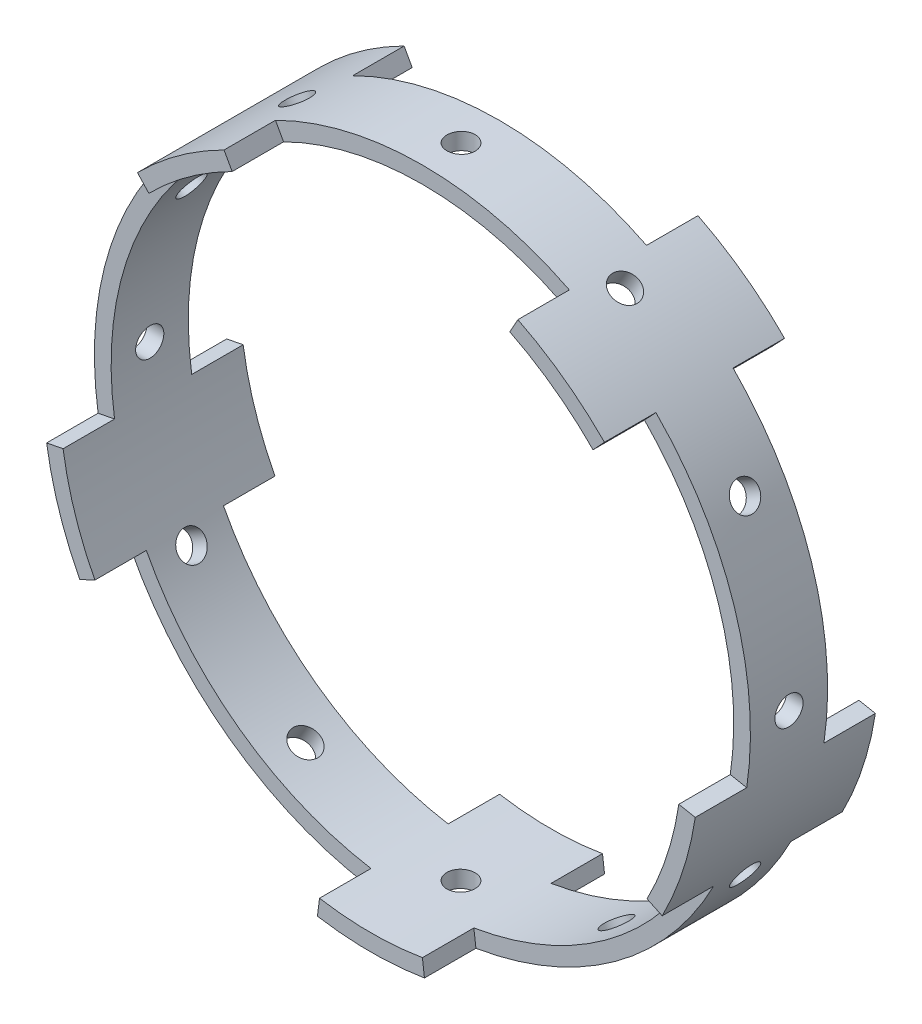
from build123d import *

# Parameters (mm, degrees)
SKETCH1_R                = 80.9625
SKETCH1_R_2              = 76.835
BOSS_EXTRUDE1_DEPTH      = 19.05
BOSS_EXTRUDE2_DEPTH      = 12.7
BOSS_EXTRUDE2_DEPTH_BACK = 31.75
SKETCH2_R                = 3.478244762368832
CUT_EXTRUDE1_DEPTH       = 119.81883399739286
CIRPATTERN1_COUNT        = 12


with BuildPart() as part:
    # Sketch1 → Boss-Extrude1 (new body)
    with BuildSketch(Plane.XY):
        Circle(SKETCH1_R)
        Circle(SKETCH1_R_2, mode=Mode.SUBTRACT)
    extrude(amount=BOSS_EXTRUDE1_DEPTH)

    # Sketch3 → Boss-Extrude2 (add, two sides: drawn at the far end of the back side and taken through both)
    with BuildSketch(Plane.XY.offset(19.05).offset(-BOSS_EXTRUDE2_DEPTH_BACK)):
        with BuildLine():
            Line((-13.20799999999999, -79.87787642551596), (-12.699999999999989, -75.77814477143133))
            ThreePointArc((-12.699999999999989, -75.77814477143133), (4.7e-15, -76.83500000000004), (12.70000000000001, -75.77814477143133))
            Line((12.70000000000001, -75.77814477143133), (13.208000000000007, -79.87787642551596))
            ThreePointArc((13.208000000000007, -79.87787642551596), (4.96e-15, -80.96249999999999), (-13.20799999999999, -79.87787642551596))
        make_face()
        with BuildLine():
            Line((-68.14478254906555, -35.49515229352562), (-71.88687842060179, -37.24517575729261))
            ThreePointArc((-71.88687842060179, -37.24517575729261), (-76.99991320054643, -25.018788407081487), (-80.04987134401034, -12.12206682283981))
            Line((-80.04987134401034, -12.12206682283981), (-75.99381420618914, -11.338316779628693))
            ThreePointArc((-75.99381420618914, -11.338316779628693), (-73.0744274295382, -23.743320762798906), (-68.14478254906555, -35.49515229352562))
        make_face()
        with BuildLine():
            Line((-54.81579177129286, 53.84093421817894), (-57.63653420906289, 56.85909189054576))
            ThreePointArc((-57.63653420906289, 56.85909189054576), (-47.58856348872898, 65.50003840708197), (-36.265541285654194, 72.38602711510362))
            Line((-36.265541285654194, 72.38602711510362), (-34.26676011416911, 68.77067962640764))
            ThreePointArc((-34.26676011416911, 68.77067962640764), (-45.16247985989187, 62.16082076279938), (-54.81579177129286, 53.84093421817894))
        make_face()
        with BuildLine():
            Line((34.2667601141701, 68.77067962640712), (36.26554128565523, 72.38602711510308))
            ThreePointArc((36.26554128565523, 72.38602711510308), (47.588563488729925, 65.50003840708128), (57.636534209063704, 56.85909189054492))
            Line((57.636534209063704, 56.85909189054492), (54.815791771293625, 53.84093421817812))
            ThreePointArc((54.815791771293625, 53.84093421817812), (45.16247985989275, 62.160820762798714), (34.2667601141701, 68.77067962640712))
        make_face()
        with BuildLine():
            Line((75.99381420618899, -11.33831677962975), (80.04987134401017, -12.122066822840925))
            ThreePointArc((80.04987134401017, -12.122066822840925), (76.99991320054609, -25.018788407082543), (71.88687842060128, -37.24517575729361))
            Line((71.88687842060128, -37.24517575729361), (68.14478254906504, -35.49515229352656))
            ThreePointArc((68.14478254906504, -35.49515229352656), (73.07442742953788, -23.743320762799915), (75.99381420618899, -11.33831677962975))
        make_face()
    extrude(amount=BOSS_EXTRUDE2_DEPTH + BOSS_EXTRUDE2_DEPTH_BACK)

    # Sketch2 → Cut-Extrude1 (cut, through all)
    with BuildSketch(Plane(origin=(0, 0, 0), x_dir=(1, 0, 0), z_dir=(0, 1, 0))):
        with Locations((0, -9.525)):
            Circle(SKETCH2_R)
    cut_extrude1 = extrude(amount=-CUT_EXTRUDE1_DEPTH, mode=Mode.SUBTRACT)

    # CirPattern1: Cut-Extrude1 ×12 about axis
    cirpattern1_axis = Axis((0, 0, 2.080715754152293), (0, 0, 1))
    for i in range(1, CIRPATTERN1_COUNT):
        add(cut_extrude1.rotate(cirpattern1_axis, i * 360 / CIRPATTERN1_COUNT), mode=Mode.SUBTRACT)


solid = part.part
